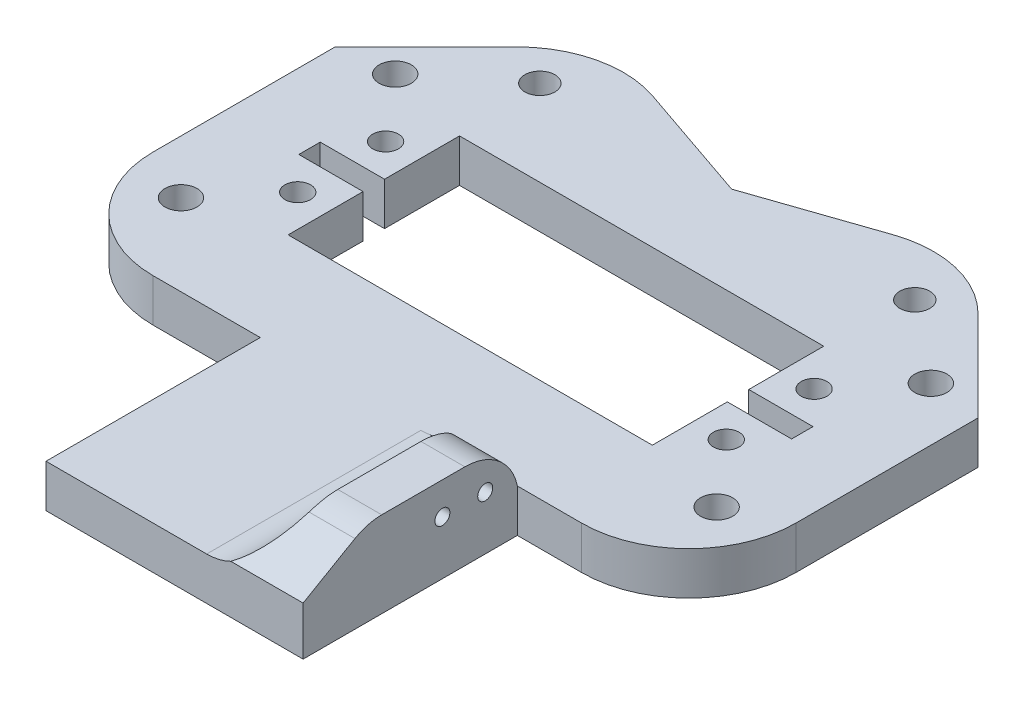
from build123d import *

# Parameters (mm, degrees)
BOSS_EXTRUDE1_DEPTH = 5.08
SKETCH2_R           = 1.778
CUT_EXTRUDE1_DEPTH  = 55.120480412
SKETCH3_W           = 43.18
SKETCH3_H           = 20.32
CUT_EXTRUDE2_DEPTH  = 55.120480412
SKETCH10_R          = 1.524
CUT_EXTRUDE3_DEPTH  = 55.120480412
SKETCH11_W          = 7.62
SKETCH11_H          = 2.54
CUT_EXTRUDE4_DEPTH  = 55.120480412
CUT_EXTRUDE5_DEPTH  = 55.120480412
SKETCH14_R          = 1.905
CUT_EXTRUDE6_DEPTH  = 55.120480412
CHAMFER1_SIZE       = 16.51
CHAMFER3_SIZE       = 16.51
FILLET1_R           = 12.7
FILLET2_R           = 12.7
SKETCH15_W          = 6.35
SKETCH15_H          = 25.4
CUT_EXTRUDE7_DEPTH  = 55.120480412
SKETCH18_W          = 25.4
SKETCH18_H          = 12.7
BOSS_EXTRUDE3_DEPTH = 5.08
SKETCH19_R          = 0.889
CUT_EXTRUDE9_DEPTH  = 69.814783295
FILLET4_R           = 6.35
SKETCH20_W          = 25.4
SKETCH20_H          = 2.54
CUT_EXTRUDE10_DEPTH = 69.814783351
CHAMFER4_SIZE       = 7.62
CHAMFER4_SIZE2      = 4.399409051
FILLET5_R           = 6.35
FILLET6_R           = 6.35


with BuildPart() as part:
    # Sketch1 → Boss-Extrude1 (new body)
    with BuildSketch(Plane(origin=(0, 0, 0), x_dir=(1, 0, 0), z_dir=(0, 1, 0))):
        Polygon((-38.1, -12.7), (-38.1, 38.1), (38.1, 38.1), (38.1, -12.7), (19.05, -12.7), (19.05, -38.1), (-19.05, -38.1), (-19.05, -12.7), align=None)
    extrude(amount=BOSS_EXTRUDE1_DEPTH)

    # Sketch2 → Cut-Extrude1 (cut, through all)
    with BuildSketch(Plane(origin=(0, 5.08, 0), x_dir=(1, 0, 0), z_dir=(0, 1, 0))):
        with Locations(Location((-22.225, 29.972, 0), (0, 0, 270))):
            Circle(SKETCH2_R)
        with Locations(Location((22.225, 29.972, 0), (0, 0, 90))):
            Circle(SKETCH2_R)
    extrude(amount=-CUT_EXTRUDE1_DEPTH, mode=Mode.SUBTRACT)

    # Sketch3 → Cut-Extrude2 (cut, through all)
    with BuildSketch(Plane(origin=(0, 5.08, 0), x_dir=(1, 0, 0), z_dir=(0, 1, 0))):
        with Locations((0, 9.652)):
            Rectangle(SKETCH3_W, SKETCH3_H)
    extrude(amount=-CUT_EXTRUDE2_DEPTH, mode=Mode.SUBTRACT)

    # Sketch10 → Cut-Extrude3 (cut, through all)
    with BuildSketch(Plane.XZ):
        with Locations(Location((25.4, -14.859, 0), (0, 0, 270))):
            Circle(SKETCH10_R)
        with Locations(Location((25.4, -4.445, 0), (0, 0, 90))):
            Circle(SKETCH10_R)
        with Locations(Location((-25.4, -14.859, 0), (0, 0, 90))):
            Circle(SKETCH10_R)
        with Locations(Location((-25.4, -4.445, 0), (0, 0, 270))):
            Circle(SKETCH10_R)
    extrude(amount=-CUT_EXTRUDE3_DEPTH, mode=Mode.SUBTRACT)

    # Sketch11 → Cut-Extrude4 (cut, through all)
    with BuildSketch(Plane.XZ):
        with Locations((25.4, -9.652)):
            Rectangle(SKETCH11_W, SKETCH11_H)
        with Locations((-25.4, -9.652)):
            Rectangle(SKETCH11_W, SKETCH11_H)
    extrude(amount=-CUT_EXTRUDE4_DEPTH, mode=Mode.SUBTRACT)

    # Sketch12 → Cut-Extrude5 (cut, through all)
    with BuildSketch(Plane.XZ):
        Polygon((22.225, -38.1), (0, -30.48), (-22.225, -38.1), align=None)
    extrude(amount=-CUT_EXTRUDE5_DEPTH, mode=Mode.SUBTRACT)

    # Sketch14 → Cut-Extrude6 (cut, through all)
    with BuildSketch(Plane.XZ):
        with Locations(Location((31.75, 3.048, 0), (0, 0, 270))):
            Circle(SKETCH14_R)
        with Locations(Location((31.75, -22.352, 0), (0, 0, 90))):
            Circle(SKETCH14_R)
        with Locations(Location((-31.75, 3.048, 0), (0, 0, 90))):
            Circle(SKETCH14_R)
        with Locations(Location((-31.75, -22.352, 0), (0, 0, 270))):
            Circle(SKETCH14_R)
    extrude(amount=-CUT_EXTRUDE6_DEPTH, mode=Mode.SUBTRACT)

    # Chamfer1
    # the kernel refuses this chamfer: 16.51 mm, written as the material it takes off along each edge
    with BuildSketch(Plane(origin=(38.1, -42.458486131, -38.1), x_dir=(0.027495876610586233, 0, 0.9996219169112966), z_dir=(0, 1, 0))) as chamfer1_piece_1:
        Polygon((CHAMFER1_SIZE * 0.999621916911, -CHAMFER1_SIZE * 0.0274958766106), (-CHAMFER1_SIZE * 0.0274958766106, -CHAMFER1_SIZE * 0.999621916911), (0, 0), align=None)
    extrude(amount=89.996972263, mode=Mode.SUBTRACT)

    # Chamfer3
    # the kernel refuses this chamfer: 16.51 mm, written as the material it takes off along each edge
    with BuildSketch(Plane(origin=(-38.1, -42.458486131, -38.1), x_dir=(-0.02749587661058624, 0, 0.9996219169112966), z_dir=(0, 1, 0))) as chamfer3_piece_1:
        Polygon((CHAMFER3_SIZE * 0.999621916911, CHAMFER3_SIZE * 0.0274958766106), (-CHAMFER3_SIZE * 0.0274958766106, CHAMFER3_SIZE * 0.999621916911), (0, 0), align=None)
    extrude(amount=89.996972263, mode=Mode.SUBTRACT)

    # Fillet1
    fillet1_edges = [part.edges().sort_by_distance(p)[0] for p in [
        (21.75212766, 2.54, -37.93787234),
        (-21.75212766, 2.54, -37.93787234),
    ]]
    fillet(fillet1_edges, radius=FILLET1_R)

    # Fillet2
    fillet2_edges = [part.edges().sort_by_distance(p)[0] for p in [
        (38.1, 2.54, 12.7),
        (-38.1, 2.54, 12.7),
    ]]
    fillet(fillet2_edges, radius=FILLET2_R)

    # Sketch15 → Cut-Extrude7 (cut, through all)
    with BuildSketch(Plane.XZ):
        with Locations((15.875, 25.4)):
            Rectangle(SKETCH15_W, SKETCH15_H)
        with Locations((-15.875, 25.4)):
            Rectangle(SKETCH15_W, SKETCH15_H)
    extrude(amount=-CUT_EXTRUDE7_DEPTH, mode=Mode.SUBTRACT)

    # Sketch18 → Boss-Extrude3 (add)
    with BuildSketch(Plane(origin=(12.7, 0, 0), x_dir=(0, 0, -1), z_dir=(1, 0, 0))):
        with Locations((-25.4, 6.35)):
            Rectangle(SKETCH18_W, SKETCH18_H)
    extrude(amount=BOSS_EXTRUDE3_DEPTH)

    # Sketch19 → Cut-Extrude9 (cut, through all)
    with BuildSketch(Plane(origin=(17.78, 0, 0), x_dir=(0, 0, -1), z_dir=(1, 0, 0))):
        with Locations((-16.51, 6.35)):
            Circle(SKETCH19_R)
        with Locations((-21.59, 6.35)):
            Circle(SKETCH19_R)
    extrude(amount=-CUT_EXTRUDE9_DEPTH, mode=Mode.SUBTRACT)

    # Fillet4
    # the kernel refuses this fillet: 6.35 mm, written as the material it adds along each edge
    with BuildSketch(Plane(origin=(12.7, 5.08, 12.7), x_dir=(-1, 0, 0), z_dir=(0, 0, 1))) as fillet4_piece_1_section:
        with BuildLine():
            CenterArc((FILLET4_R, -FILLET4_R), FILLET4_R, 90, 90)
            Line((0, -FILLET4_R), (0, 0))
            Line((0, 0), (FILLET4_R, 0))
        make_face()
    fillet4_piece_1 = extrude(amount=25.4, mode=Mode.PRIVATE)
    fillet4_piece_1 = fillet4_piece_1 - Plane(origin=(11.255700074, 6.35, 16.51), x_dir=(0, 0, -1), z_dir=(1, 0, 0)) * Cylinder(0.889, 77, mode=Mode.PRIVATE)
    fillet4_piece_1 = fillet4_piece_1 - Plane(origin=(11.255700074, 6.35, 21.59), x_dir=(0, 0, -1), z_dir=(1, 0, 0)) * Cylinder(0.889, 77, mode=Mode.PRIVATE)
    add(fillet4_piece_1)

    # Sketch20 → Cut-Extrude10 (cut, through all)
    with BuildSketch(Plane(origin=(17.78, 0, 0), x_dir=(0, 0, -1), z_dir=(1, 0, 0))):
        with Locations((-25.4, 11.43)):
            Rectangle(SKETCH20_W, SKETCH20_H)
    extrude(amount=-CUT_EXTRUDE10_DEPTH, mode=Mode.SUBTRACT)

    # Chamfer4
    chamfer4_edges = [part.edges().sort_by_distance(p)[0] for p in [
        (15.175851973, 10.16, 38.1),
    ]]
    chamfer4_side = [part.faces().sort_by_distance(p)[0] for p in [
        (15.175851973, 10.16, 25.4),
    ]]
    chamfer(chamfer4_edges, length=CHAMFER4_SIZE, length2=CHAMFER4_SIZE2, reference=chamfer4_side[0])

    # Fillet5
    fillet5_edges = [part.edges().sort_by_distance(p)[0] for p in [
        (15.175851973, 10.16, 30.48),
    ]]
    fillet(fillet5_edges, radius=FILLET5_R)

    # Fillet6
    # the kernel refuses this fillet: 6.35 mm, written as the material it takes off along each edge
    with BuildSketch(Plane(origin=(33.334259867, 10.16, 12.7), x_dir=(0, 0, 1), z_dir=(-1, 0, 0))) as fillet6_piece_1:
        with BuildLine():
            CenterArc((6.221703947, -6.35), FILLET6_R, 90, 78.463040967)
            Line((0, -5.08), (-0.124434079, -5.0546))
            ThreePointArc((-0.124434079, -5.0546), (-0.127, -2.54), (-0.127, 0))
            Line((-0.127, 0), (0, 0.127))
            Line((0, 0.127), (6.221703947, 0.127))
            Line((6.221703947, 0.127), (6.221703947, 0))
        make_face()
    extrude(amount=36.316815787, mode=Mode.SUBTRACT)


solid = part.part
